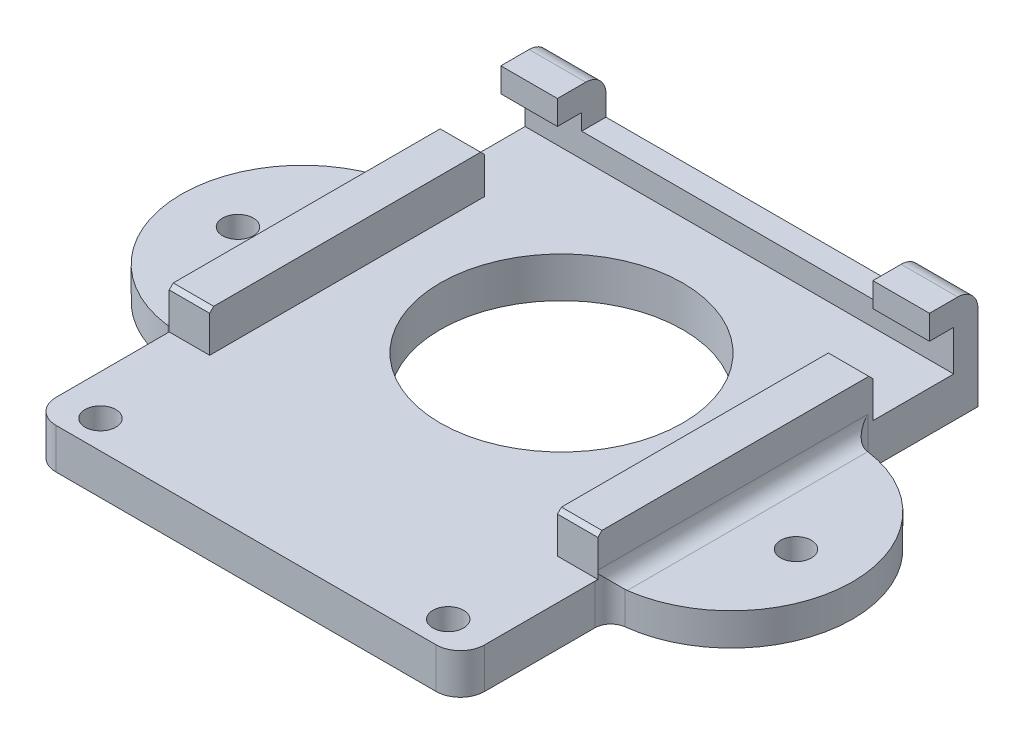
from build123d import *

# Parameters (mm, degrees)
SKETCH1_W           = 53
SKETCH1_H           = 61
BOSS_EXTRUDE1_DEPTH = 5
SKETCH2_W           = 5
SKETCH2_H           = 34
BOSS_EXTRUDE2_DEPTH = 5
SKETCH3_W           = 53
SKETCH3_H           = 5
BOSS_EXTRUDE3_DEPTH = 3
SKETCH4_W           = 53
SKETCH4_H           = 3
BOSS_EXTRUDE4_DEPTH = 8
SKETCH5_W           = 53
SKETCH5_H           = 3
BOSS_EXTRUDE5_DEPTH = 3
CUT_EXTRUDE1_REACH  = 83.847
SKETCH6_W           = 19.5
SKETCH6_H           = 6
CHAMFER1_SIZE       = 0.5
FILLET1_R           = 2.5
SKETCH7_R           = 15
CUT_EXTRUDE2_DEPTH  = 5
FILLET2_R           = 3
SKETCH8_W           = 39
SKETCH8_H           = 3
BOSS_EXTRUDE6_DEPTH = 3
SKETCH10_R          = 1.9
BOSS_EXTRUDE7_DEPTH = 4
FILLET3_START       = 4
FILLET3_DEPTH       = 2
FILLET3_2_DEPTH     = 5
FILLET3_START_2     = 10
FILLET3_3_DEPTH     = 34.381943016
SKETCH11_R          = 1.9
CUT_EXTRUDE3_DEPTH  = 5


with BuildPart() as part:
    # Sketch1 → Boss-Extrude1 (new body)
    with BuildSketch(Plane(origin=(0, 0, 0), x_dir=(1, 0, 0), z_dir=(0, 1, 0))):
        with Locations((26.5, -30.5)):
            Rectangle(SKETCH1_W, SKETCH1_H)
    extrude(amount=BOSS_EXTRUDE1_DEPTH)

    # Sketch2 → Boss-Extrude2 (add)
    with BuildSketch(Plane(origin=(0, 5, 0), x_dir=(1, 0, 0), z_dir=(0, 1, 0))):
        with Locations((2.5, -27)):
            Rectangle(SKETCH2_W, SKETCH2_H)
        with Locations((50.5, -27)):
            Rectangle(SKETCH2_W, SKETCH2_H)
    extrude(amount=BOSS_EXTRUDE2_DEPTH)

    # Sketch3 → Boss-Extrude3 (add)
    with BuildSketch(Plane(origin=(0, 0, 0), x_dir=(-1, 0, 0), z_dir=(0, 0, -1))):
        with Locations((-26.5, 2.5)):
            Rectangle(SKETCH3_W, SKETCH3_H)
    extrude(amount=BOSS_EXTRUDE3_DEPTH)

    # Sketch4 → Boss-Extrude4 (add)
    with BuildSketch(Plane(origin=(0, 5, 0), x_dir=(1, 0, 0), z_dir=(0, 1, 0))):
        with Locations((26.5, 1.5)):
            Rectangle(SKETCH4_W, SKETCH4_H)
    extrude(amount=BOSS_EXTRUDE4_DEPTH)

    # Sketch5 → Boss-Extrude5 (add)
    with BuildSketch(Plane.XY):
        with Locations((26.5, 11.5)):
            Rectangle(SKETCH5_W, SKETCH5_H)
    extrude(amount=BOSS_EXTRUDE5_DEPTH)

    # Cut-Extrude1: up to this face of the body (flat: up to its plane)
    cut_extrude1_end = Plane(part.part.faces().sort_by_distance((26.5, 5, 30.911337712))[0])
    # Sketch6 → Cut-Extrude1 (cut, up to the picked face)
    with BuildSketch(Plane(origin=(0, 13, 0), x_dir=(1, 0, 0), z_dir=(0, 1, 0)), mode=Mode.PRIVATE) as cut_extrude1_sk1:
        with Locations((36.25, 0)):
            Rectangle(SKETCH6_W, SKETCH6_H)
    cut_extrude1_tool1 = split(extrude(cut_extrude1_sk1.sketch, amount=-CUT_EXTRUDE1_REACH, mode=Mode.PRIVATE), bisect_by=cut_extrude1_end, keep=Keep.BOTH, mode=Mode.PRIVATE)
    # Sketch6 → Cut-Extrude1 (cut, up to the picked face)
    with BuildSketch(Plane(origin=(0, 13, 0), x_dir=(1, 0, 0), z_dir=(0, 1, 0)), mode=Mode.PRIVATE) as cut_extrude1_sk2:
        with Locations((16.75, 0)):
            Rectangle(SKETCH6_W, SKETCH6_H)
    cut_extrude1_tool2 = split(extrude(cut_extrude1_sk2.sketch, amount=-CUT_EXTRUDE1_REACH, mode=Mode.PRIVATE), bisect_by=cut_extrude1_end, keep=Keep.BOTH, mode=Mode.PRIVATE)
    add(cut_extrude1_tool1.solids().sort_by(Axis((36.25, 13, 0), (0, -1, 0)))[0], mode=Mode.SUBTRACT)
    add(cut_extrude1_tool2.solids().sort_by(Axis((16.75, 13, 0), (0, -1, 0)))[0], mode=Mode.SUBTRACT)

    # Chamfer1
    chamfer1_edges = [part.edges().sort_by_distance(p)[0] for p in [
        (2.5, 10, 10),
        (2.5, 10, 44),
        (50.5, 10, 44),
        (50.5, 10, 10),
    ]]
    chamfer(chamfer1_edges, length=CHAMFER1_SIZE)

    # Fillet1
    fillet1_edges = [part.edges().sort_by_distance(p)[0] for p in [
        (3.5, 13, -3),
        (49.5, 13, -3),
    ]]
    fillet(fillet1_edges, radius=FILLET1_R)

    # Sketch7 → Cut-Extrude2 (cut)
    with BuildSketch(Plane(origin=(0, 5, 0), x_dir=(1, 0, 0), z_dir=(0, 1, 0))):
        with Locations(Location((26.5, -22, 0), (0, 0, 270))):
            Circle(SKETCH7_R)
    extrude(amount=-CUT_EXTRUDE2_DEPTH, mode=Mode.SUBTRACT)

    # Fillet2
    fillet2_edges = [part.edges().sort_by_distance(p)[0] for p in [
        (53, 2.5, 61),
        (0, 2.5, 61),
    ]]
    fillet(fillet2_edges, radius=FILLET2_R)

    # Sketch8 → Boss-Extrude6 (add)
    with BuildSketch(Plane(origin=(0, 5, 0), x_dir=(1, 0, 0), z_dir=(0, 1, 0))):
        with Locations((26.5, 1.5)):
            Rectangle(SKETCH8_W, SKETCH8_H)
    extrude(amount=BOSS_EXTRUDE6_DEPTH)

    # Sketch10 → Boss-Extrude7 (add)
    # profile 1 of 2: a face of its own
    with BuildSketch(Plane.XZ):
        with BuildLine():
            Line((53, 12.5), (53, 42.5))
            ThreePointArc((53, 42.5), (68, 27.5), (53, 12.5))
        make_face()
        with Locations(Location((61, 27.5, 0), (0, 0, 90))):
            Circle(SKETCH10_R, mode=Mode.SUBTRACT)
    # profile 2 of 2: a face of its own
    with BuildSketch(Plane.XZ):
        with BuildLine():
            Line((0, 12.5), (0, 42.5))
            ThreePointArc((0, 42.5), (-15, 27.5), (0, 12.5))
        make_face()
        with Locations(Location((-8, 27.5, 0), (0, 0, 270))):
            Circle(SKETCH10_R, mode=Mode.SUBTRACT)
    extrude(amount=-BOSS_EXTRUDE7_DEPTH)

    # Fillet3: read off the stored shape, not the designer's step
    # Fillet3 outline → Fillet3 (add)
    with BuildSketch(Plane(origin=(0, 0, 0), x_dir=(1, 0, 0), z_dir=(0, 1, 0)).offset(FILLET3_START)):
        with BuildLine():
            ThreePointArc((0, -10.618056984), (-0.504909997, -11.946479312), (-1.764705882, -12.604167927))
            ThreePointArc((-1.764705882, -12.604167927), (-15, -27.5), (-1.764705882, -42.395832073))
            ThreePointArc((-1.764705882, -42.395832073), (-0.639238058, -42.916225808), (-0.03680884, -44))
            Line((-0.03680884, -44), (0, -44))
            Line((0, -44), (0, -10.618056984))
        make_face()
        with BuildLine():
            Line((53, -44), (53.03680884, -44))
            ThreePointArc((53.03680884, -44), (53.639238058, -42.916225808), (54.764705882, -42.395832073))
            ThreePointArc((54.764705882, -42.395832073), (68, -27.5), (54.764705882, -12.604167927))
            ThreePointArc((54.764705882, -12.604167927), (53.504909997, -11.946479312), (53, -10.618056984))
            Line((53, -10.618056984), (53, -44))
        make_face()
    extrude(amount=FILLET3_DEPTH)

    # Fillet3 2 outline → Fillet3 2 (add)
    with BuildSketch(Plane(origin=(0, 0, 0), x_dir=(1, 0, 0), z_dir=(0, 1, 0))):
        with BuildLine():
            Line((0, -12.5), (0, -10.618056984))
            ThreePointArc((0, -10.618056984), (-0.504909997, -11.946479312), (-1.764705882, -12.604167927))
            ThreePointArc((-1.764705882, -12.604167927), (-0.883888823, -12.526064627), (0, -12.5))
        make_face()
        with BuildLine():
            ThreePointArc((0, -42.5), (-0.883888823, -42.473935373), (-1.764705882, -42.395832073))
            ThreePointArc((-1.764705882, -42.395832073), (-0.504909997, -43.053520688), (0, -44.381943016))
            Line((0, -44.381943016), (0, -42.5))
        make_face()
        with BuildLine():
            ThreePointArc((53, -44.381943016), (53.504909997, -43.053520688), (54.764705882, -42.395832073))
            ThreePointArc((54.764705882, -42.395832073), (53.883888823, -42.473935373), (53, -42.5))
            Line((53, -42.5), (53, -44.381943016))
        make_face()
        with BuildLine():
            ThreePointArc((53, -12.5), (53.883888823, -12.526064627), (54.764705882, -12.604167927))
            ThreePointArc((54.764705882, -12.604167927), (53.504909997, -11.946479312), (53, -10.618056984))
            Line((53, -10.618056984), (53, -12.5))
        make_face()
    extrude(amount=FILLET3_2_DEPTH)

    # Fillet3 3 outline → Fillet3 3 (cut)
    with BuildSketch(Plane.XY.offset(FILLET3_START_2)):
        with BuildLine():
            Line((-16, 4), (-2, 4))
            ThreePointArc((-2, 4), (-0.585786438, 4.585786438), (0, 6))
            Line((0, 6), (-16, 6))
            Line((-16, 6), (-16, 4))
        make_face()
        with BuildLine():
            ThreePointArc((53, 6), (53.585786438, 4.585786438), (55, 4))
            Line((55, 4), (69, 4))
            Line((69, 4), (69, 6))
            Line((69, 6), (53, 6))
        make_face()
    extrude(amount=FILLET3_3_DEPTH, mode=Mode.SUBTRACT)

    # Sketch11 → Cut-Extrude3 (cut)
    with BuildSketch(Plane(origin=(0, 5, 0), x_dir=(1, 0, 0), z_dir=(0, 1, 0))):
        with Locations(Location((5, -57.5, 0), (0, 0, 270))):
            Circle(SKETCH11_R)
        with Locations(Location((48, -57.5, 0), (0, 0, 270))):
            Circle(SKETCH11_R)
    extrude(amount=-CUT_EXTRUDE3_DEPTH, mode=Mode.SUBTRACT)


solid = part.part
